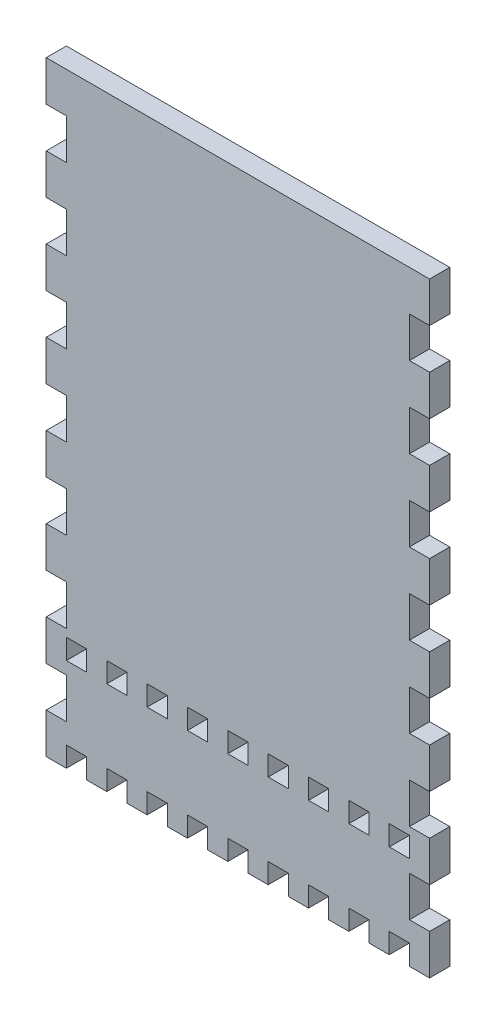
from build123d import *

# Parameters (mm, degrees)
SKETCH1_W           = 120.65
SKETCH1_H           = 190.5
BOSS_EXTRUDE1_DEPTH = 6.35
CAVITY1_START       = -19.05
CAVITY1_OUTLINE_W   = 6.35
CAVITY1_OUTLINE_H   = 6.35
CAVITY1_DEPTH       = 6.35
CAVITY1_START_2     = 10.31875
CAVITY1_2_OUTLINE_W = 6.35
CAVITY1_2_OUTLINE_H = 6.35
CAVITY1_2_DEPTH     = 6.35
CAVITY1_START_3     = -6.35
CAVITY1_3_OUTLINE_W = 6.35
CAVITY1_3_OUTLINE_H = 6.35
CAVITY1_3_DEPTH     = 12.7
CAVITY1_START_4     = 19.05
CAVITY1_4_OUTLINE_W = 6.35
CAVITY1_4_OUTLINE_H = 6.35
CAVITY1_4_DEPTH     = 12.7
CAVITY1_START_5     = 44.45
CAVITY1_5_OUTLINE_W = 6.35
CAVITY1_5_OUTLINE_H = 6.35
CAVITY1_5_DEPTH     = 12.7
CAVITY1_START_6     = 69.85
CAVITY1_6_OUTLINE_W = 6.35
CAVITY1_6_OUTLINE_H = 6.35
CAVITY1_6_DEPTH     = 12.7
CAVITY1_START_7     = 95.25
CAVITY1_7_OUTLINE_W = 6.35
CAVITY1_7_OUTLINE_H = 6.35
CAVITY1_7_DEPTH     = 12.7
CAVITY1_START_8     = 120.65
CAVITY1_8_OUTLINE_W = 6.35
CAVITY1_8_OUTLINE_H = 6.35
CAVITY1_8_DEPTH     = 12.7
CAVITY1_START_9     = 146.05
CAVITY1_9_OUTLINE_W = 6.35
CAVITY1_9_OUTLINE_H = 6.35
CAVITY1_9_DEPTH     = 12.7


# Read off the part's stored shape, not the designer's step: Cavity1
with BuildPart() as part:
    # Sketch1 → Boss-Extrude1 (new body)
    with BuildSketch(Plane.XY):
        with Locations((15.875, 76.2)):
            Rectangle(SKETCH1_W, SKETCH1_H)
    extrude(amount=BOSS_EXTRUDE1_DEPTH)

    # Cavity1 outline → Cavity1 (cut)
    with BuildSketch(Plane(origin=(0, 0, 0), x_dir=(1, 0, 0), z_dir=(0, 1, 0)).offset(CAVITY1_START)):
        with Locations((66.675, -3.175)):
            Rectangle(CAVITY1_OUTLINE_W, CAVITY1_OUTLINE_H)
        with Locations((53.975, -3.175)):
            Rectangle(CAVITY1_OUTLINE_W, CAVITY1_OUTLINE_H)
        with Locations((41.275, -3.175)):
            Rectangle(CAVITY1_OUTLINE_W, CAVITY1_OUTLINE_H)
        with Locations((28.575, -3.175)):
            Rectangle(CAVITY1_OUTLINE_W, CAVITY1_OUTLINE_H)
        with Locations((15.875, -3.175)):
            Rectangle(CAVITY1_OUTLINE_W, CAVITY1_OUTLINE_H)
        with Locations((3.175, -3.175)):
            Rectangle(CAVITY1_OUTLINE_W, CAVITY1_OUTLINE_H)
        with Locations((-9.525, -3.175)):
            Rectangle(CAVITY1_OUTLINE_W, CAVITY1_OUTLINE_H)
        with Locations((-22.225, -3.175)):
            Rectangle(CAVITY1_OUTLINE_W, CAVITY1_OUTLINE_H)
        with Locations((-34.925, -3.175)):
            Rectangle(CAVITY1_OUTLINE_W, CAVITY1_OUTLINE_H)
    extrude(amount=CAVITY1_DEPTH, mode=Mode.SUBTRACT)

    # Cavity1 2 outline → Cavity1 2 (cut)
    with BuildSketch(Plane(origin=(0, 0, 0), x_dir=(1, 0, 0), z_dir=(0, 1, 0)).offset(CAVITY1_START_2)):
        with Locations((66.675, -3.175)):
            Rectangle(CAVITY1_2_OUTLINE_W, CAVITY1_2_OUTLINE_H)
        with Locations((53.975, -3.175)):
            Rectangle(CAVITY1_2_OUTLINE_W, CAVITY1_2_OUTLINE_H)
        with Locations((41.275, -3.175)):
            Rectangle(CAVITY1_2_OUTLINE_W, CAVITY1_2_OUTLINE_H)
        with Locations((28.575, -3.175)):
            Rectangle(CAVITY1_2_OUTLINE_W, CAVITY1_2_OUTLINE_H)
        with Locations((15.875, -3.175)):
            Rectangle(CAVITY1_2_OUTLINE_W, CAVITY1_2_OUTLINE_H)
        with Locations((3.175, -3.175)):
            Rectangle(CAVITY1_2_OUTLINE_W, CAVITY1_2_OUTLINE_H)
        with Locations((-9.525, -3.175)):
            Rectangle(CAVITY1_2_OUTLINE_W, CAVITY1_2_OUTLINE_H)
        with Locations((-22.225, -3.175)):
            Rectangle(CAVITY1_2_OUTLINE_W, CAVITY1_2_OUTLINE_H)
        with Locations((-34.925, -3.175)):
            Rectangle(CAVITY1_2_OUTLINE_W, CAVITY1_2_OUTLINE_H)
    extrude(amount=CAVITY1_2_DEPTH, mode=Mode.SUBTRACT)

    # Cavity1 3 outline → Cavity1 3 (cut)
    with BuildSketch(Plane(origin=(0, 0, 0), x_dir=(1, 0, 0), z_dir=(0, 1, 0)).offset(CAVITY1_START_3)):
        with Locations((73.025, -3.175)):
            Rectangle(CAVITY1_3_OUTLINE_W, CAVITY1_3_OUTLINE_H)
        with Locations((-41.275, -3.175)):
            Rectangle(CAVITY1_3_OUTLINE_W, CAVITY1_3_OUTLINE_H)
    extrude(amount=CAVITY1_3_DEPTH, mode=Mode.SUBTRACT)

    # Cavity1 4 outline → Cavity1 4 (cut)
    with BuildSketch(Plane(origin=(0, 0, 0), x_dir=(1, 0, 0), z_dir=(0, 1, 0)).offset(CAVITY1_START_4)):
        with Locations((73.025, -3.175)):
            Rectangle(CAVITY1_4_OUTLINE_W, CAVITY1_4_OUTLINE_H)
        with Locations((-41.275, -3.175)):
            Rectangle(CAVITY1_4_OUTLINE_W, CAVITY1_4_OUTLINE_H)
    extrude(amount=CAVITY1_4_DEPTH, mode=Mode.SUBTRACT)

    # Cavity1 5 outline → Cavity1 5 (cut)
    with BuildSketch(Plane(origin=(0, 0, 0), x_dir=(1, 0, 0), z_dir=(0, 1, 0)).offset(CAVITY1_START_5)):
        with Locations((73.025, -3.175)):
            Rectangle(CAVITY1_5_OUTLINE_W, CAVITY1_5_OUTLINE_H)
        with Locations((-41.275, -3.175)):
            Rectangle(CAVITY1_5_OUTLINE_W, CAVITY1_5_OUTLINE_H)
    extrude(amount=CAVITY1_5_DEPTH, mode=Mode.SUBTRACT)

    # Cavity1 6 outline → Cavity1 6 (cut)
    with BuildSketch(Plane(origin=(0, 0, 0), x_dir=(1, 0, 0), z_dir=(0, 1, 0)).offset(CAVITY1_START_6)):
        with Locations((73.025, -3.175)):
            Rectangle(CAVITY1_6_OUTLINE_W, CAVITY1_6_OUTLINE_H)
        with Locations((-41.275, -3.175)):
            Rectangle(CAVITY1_6_OUTLINE_W, CAVITY1_6_OUTLINE_H)
    extrude(amount=CAVITY1_6_DEPTH, mode=Mode.SUBTRACT)

    # Cavity1 7 outline → Cavity1 7 (cut)
    with BuildSketch(Plane(origin=(0, 0, 0), x_dir=(1, 0, 0), z_dir=(0, 1, 0)).offset(CAVITY1_START_7)):
        with Locations((73.025, -3.175)):
            Rectangle(CAVITY1_7_OUTLINE_W, CAVITY1_7_OUTLINE_H)
        with Locations((-41.275, -3.175)):
            Rectangle(CAVITY1_7_OUTLINE_W, CAVITY1_7_OUTLINE_H)
    extrude(amount=CAVITY1_7_DEPTH, mode=Mode.SUBTRACT)

    # Cavity1 8 outline → Cavity1 8 (cut)
    with BuildSketch(Plane(origin=(0, 0, 0), x_dir=(1, 0, 0), z_dir=(0, 1, 0)).offset(CAVITY1_START_8)):
        with Locations((73.025, -3.175)):
            Rectangle(CAVITY1_8_OUTLINE_W, CAVITY1_8_OUTLINE_H)
        with Locations((-41.275, -3.175)):
            Rectangle(CAVITY1_8_OUTLINE_W, CAVITY1_8_OUTLINE_H)
    extrude(amount=CAVITY1_8_DEPTH, mode=Mode.SUBTRACT)

    # Cavity1 9 outline → Cavity1 9 (cut)
    with BuildSketch(Plane(origin=(0, 0, 0), x_dir=(1, 0, 0), z_dir=(0, 1, 0)).offset(CAVITY1_START_9)):
        with Locations((73.025, -3.175)):
            Rectangle(CAVITY1_9_OUTLINE_W, CAVITY1_9_OUTLINE_H)
        with Locations((-41.275, -3.175)):
            Rectangle(CAVITY1_9_OUTLINE_W, CAVITY1_9_OUTLINE_H)
    extrude(amount=CAVITY1_9_DEPTH, mode=Mode.SUBTRACT)


solid = part.part
